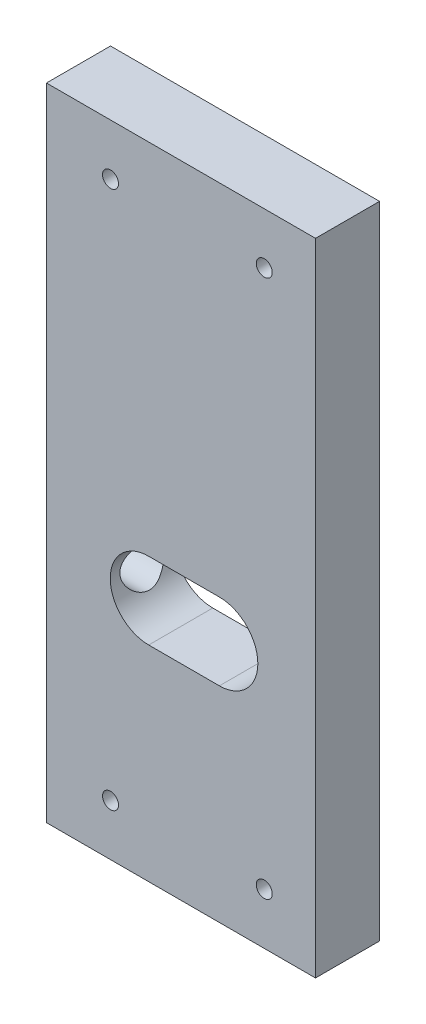
from build123d import *

# Parameters (mm, degrees)
SKETCH1_W                      = 42
SKETCH1_H                      = 100
BOSS_EXTRUDE1_DEPTH            = 10
CUT_EXTRUDE1_DEPTH             = 56.145262716
F_2_5_2_5_DIAMETER_HOLE1_D     = 2.5
F_2_5_2_5_DIAMETER_HOLE2_D     = 2.5
F_2_5_2_5_DIAMETER_HOLE2_DEPTH = 7.5
F_2_5_2_5_DIAMETER_HOLE2_TIP   = 0.751075774


# Read off the part's stored shape, not the designer's step: CBORE for M6 Hex Head Bolt1
with BuildPart() as part:
    # Sketch1 → Boss-Extrude1 (new body)
    with BuildSketch(Plane.XY.offset(10)):
        Rectangle(SKETCH1_W, SKETCH1_H)
    extrude(amount=-BOSS_EXTRUDE1_DEPTH)

    # Sketch2 → Cut-Extrude1 (cut, through all)
    with BuildSketch(Plane(origin=(0, 0, 0), x_dir=(-1, 0, 0), z_dir=(0, 0, -1))):
        with BuildLine():
            Line((5.04, -6), (-6, -6))
            ThreePointArc((-6, -6), (-12, -12), (-6, -18))
            Line((-6, -18), (5.04, -18))
            ThreePointArc((5.04, -18), (11.04, -12), (5.04, -6))
        make_face()
    extrude(amount=-CUT_EXTRUDE1_DEPTH, mode=Mode.SUBTRACT)

    # Ø2.5 (2.5) Diameter Hole1 (through all)
    with Locations(Plane.XY.offset(10)):
        with Locations((13, 42), (-11, 42), (-11, -42), (13, -42)):
            Hole(F_2_5_2_5_DIAMETER_HOLE1_D / 2)

    # CBORE for M6 Hex Head Bolt1 outline → CBORE for M6 Hex Head Bolt1 (revolve, cut)
    with BuildSketch(Plane(origin=(0, -12, 5), x_dir=(0, 1, 0), z_dir=(0, 0, -1))):
        Polygon((3.5, -16), (3.5, -9.913035616), (0, -9.913035616), (0, -21), (4.5, -21), (4.5, -16), align=None)
    revolve(axis=Axis((0, -12, 5), (1, 0, 0)), mode=Mode.SUBTRACT)

    # Ø2.5 (2.5) Diameter Hole2
    with Locations(Plane.ZY.offset(21)):
        with Locations((5, 45), (5, -45)):
            Hole(F_2_5_2_5_DIAMETER_HOLE2_D / 2, depth=F_2_5_2_5_DIAMETER_HOLE2_DEPTH)
            with Locations((0, 0, -(F_2_5_2_5_DIAMETER_HOLE2_DEPTH + F_2_5_2_5_DIAMETER_HOLE2_TIP / 2))):  # 118° drill point
                Cone(0, F_2_5_2_5_DIAMETER_HOLE2_D / 2, F_2_5_2_5_DIAMETER_HOLE2_TIP, mode=Mode.SUBTRACT)


solid = part.part
